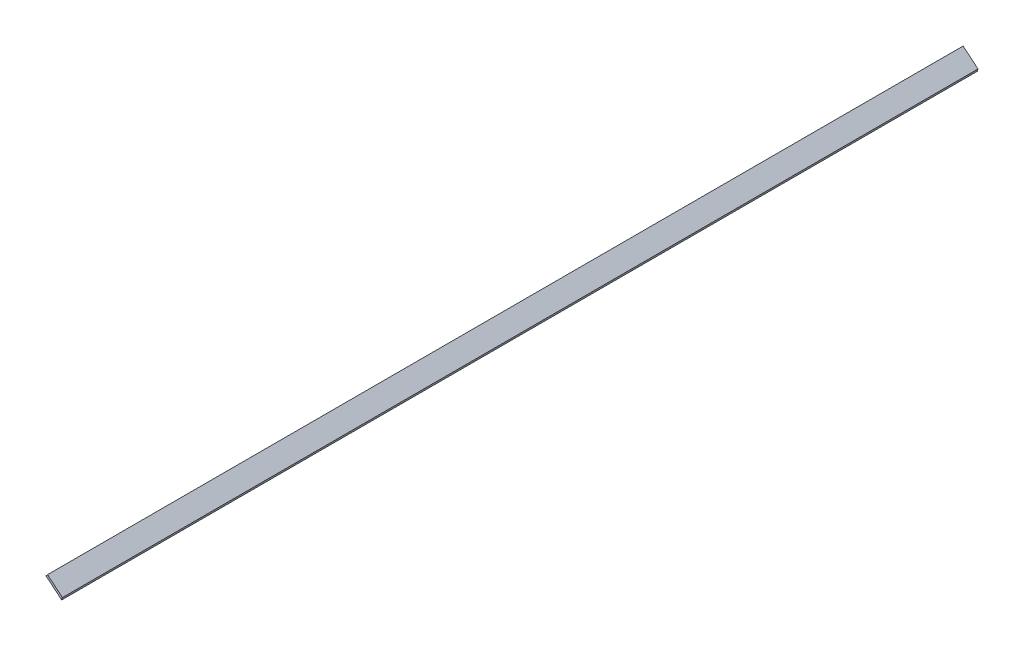
from build123d import *

# Parameters (mm, degrees)
BOSS_EXTRUDE1_DEPTH = 901.7


with BuildPart() as part:
    # Sketch1 → Boss-Extrude1 (new body)
    with BuildSketch(Plane.XY):
        Polygon((0, 0), (0.760500689, 2.441106772), (-13.90332143, 14.660218213), (-15.415510947, 12.845480848), align=None)
    extrude(amount=BOSS_EXTRUDE1_DEPTH)


solid = part.part
